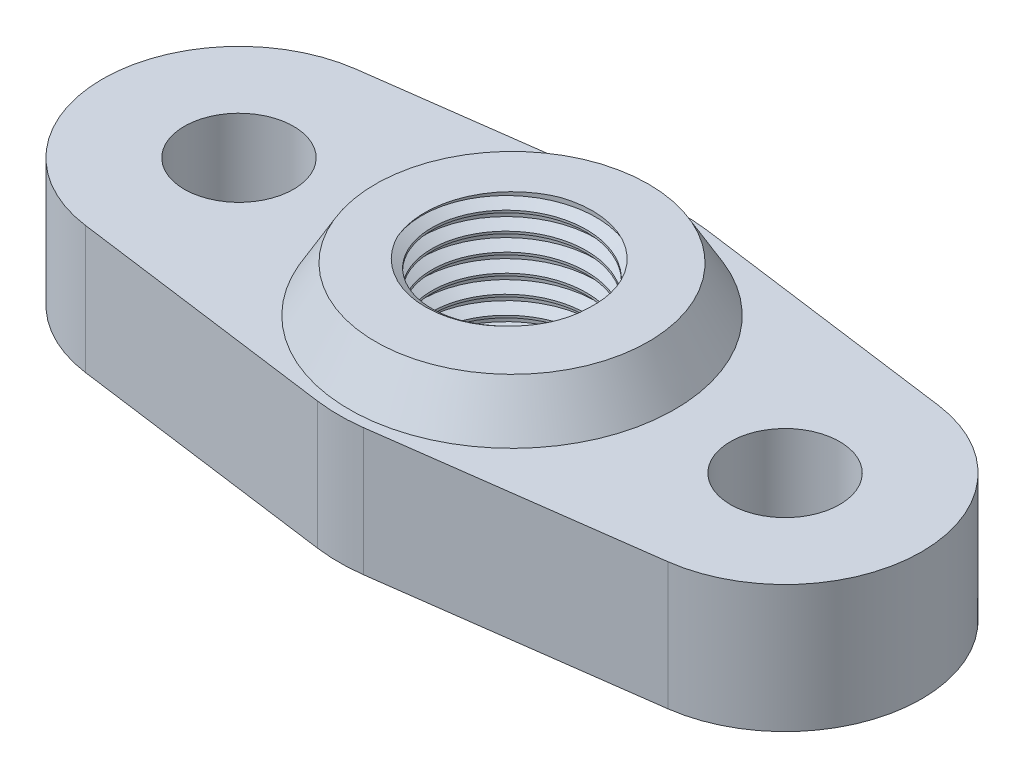
from build123d import *

# Parameters (mm, degrees)
BOSS_EXTRUDE1_DEPTH    = 28
CUT_EXTRUDE1_REACH     = 103.627
SKETCH3_R              = 12
F_25_0MM_DOWEL_HOLE1_D = 34
THREAD1_PITCH          = 4


with BuildPart() as part:
    # Sketch1 → Boss-Extrude1 (new body)
    with BuildSketch(Plane(origin=(0, 0, 0), x_dir=(1, 0, 0), z_dir=(0, 1, 0))):
        with BuildLine():
            Line((-64, 29.732137495), (-5.066666667, 37.660707493))
            ThreePointArc((-5.066666667, 37.660707493), (0, 38), (5.066666667, 37.660707493))
            Line((5.066666667, 37.660707493), (64, 29.732137495))
            ThreePointArc((64, 29.732137495), (90, 0), (64, -29.732137495))
            Line((64, -29.732137495), (5.066666667, -37.660707493))
            ThreePointArc((5.066666667, -37.660707493), (0, -38), (-5.066666667, -37.660707493))
            Line((-5.066666667, -37.660707493), (-64, -29.732137495))
            ThreePointArc((-64, -29.732137495), (-90, 0), (-64, 29.732137495))
        make_face()
    extrude(amount=BOSS_EXTRUDE1_DEPTH)

    # Sketch2 → Revolve1 (revolve)
    with BuildSketch(Plane.XY, mode=Mode.PRIVATE) as revolve1_sk:
        Polygon((0, 38), (-30, 38), (-35.773502692, 28), (0, 28), align=None)
    revolve(revolve1_sk.sketch.rotate(Axis((0, 0, 0), (0, 1, 0)), 270), axis=Axis((0, 0, 0), (0, 1, 0)))

    # Sketch3 → Cut-Extrude1 (cut, up to next)
    with BuildSketch(Plane(origin=(0, 28, 0), x_dir=(1, 0, 0), z_dir=(0, 1, 0)), mode=Mode.PRIVATE) as cut_extrude1_sk1:
        with Locations(Location((-60, 0, 0), (0, 0, 270))):
            Circle(SKETCH3_R)
    cut_extrude1_tool1 = extrude(cut_extrude1_sk1.sketch, amount=-CUT_EXTRUDE1_REACH, mode=Mode.PRIVATE) & part.part
    # Sketch3 → Cut-Extrude1 (cut, up to next)
    with BuildSketch(Plane(origin=(0, 28, 0), x_dir=(1, 0, 0), z_dir=(0, 1, 0)), mode=Mode.PRIVATE) as cut_extrude1_sk2:
        with Locations(Location((60, 0, 0), (0, 0, 270))):
            Circle(SKETCH3_R)
    cut_extrude1_tool2 = extrude(cut_extrude1_sk2.sketch, amount=-CUT_EXTRUDE1_REACH, mode=Mode.PRIVATE) & part.part
    add(cut_extrude1_tool1.solids().sort_by_distance((-60, 28, 0))[0], mode=Mode.SUBTRACT)
    add(cut_extrude1_tool2.solids().sort_by_distance((60, 28, 0))[0], mode=Mode.SUBTRACT)

    # Ø25.0mm Dowel Hole1 (through all)
    with Locations(Plane(origin=(0, 38, 0), x_dir=(1, 0, 0), z_dir=(0, 1, 0))):
        with Locations((0, 0)):
            Hole(F_25_0MM_DOWEL_HOLE1_D / 2)

    # Thread1: the profile of Thread Profile1 profile screwed along a right-hand helix of 12 turns, 12 arcs to a turn; built about Z, then put on its axis
    thread1_z = Axis((0, 0, 0), (0, 0, 1))
    thread1_corners = [(16.9997, 0, -0.000173205), (16.9997, 0, 3.500173194), (19.1650635, 0, 2.249999995), (19.1650635, 0, 1.249999995)]
    with BuildLine(mode=Mode.PRIVATE) as thread1_profile:
        Line(thread1_corners[0], thread1_corners[1])
        Line(thread1_corners[1], thread1_corners[2])
        Line(thread1_corners[2], thread1_corners[3])
        Line(thread1_corners[3], thread1_corners[0])
    thread1_cap = Face(thread1_profile.wire())
    thread1_turn_angles = [0, 15, 30, 45, 60, 75, 90, 105, 120, 135, 150, 165, 180, 195, 210, 225, 240, 255, 270, 285, 300, 315, 330, 345, 360]
    thread1_turn_weights = [1, 0.9659258262890683, 1, 0.9659258262890683, 1, 0.9659258262890683, 1, 0.9659258262890683, 1, 0.9659258262890683, 1, 0.9659258262890683, 1, 0.9659258262890683, 1, 0.9659258262890683, 1, 0.9659258262890683, 1, 0.9659258262890683, 1, 0.9659258262890683, 1, 0.9659258262890683, 1]
    thread1_turn_rails = [Edge.make_bspline([Vector(p[0], p[1], 0).rotate(thread1_z, thread1_turn_angles[k]) / thread1_turn_weights[k] + Vector(0, 0, p[2] + THREAD1_PITCH * thread1_turn_angles[k] / 360) for k in range(25)], [0, 0, 0, 1, 1, 2, 2, 3, 3, 4, 4, 5, 5, 6, 6, 7, 7, 8, 8, 9, 9, 10, 10, 11, 11, 12, 12, 12], 2, thread1_turn_weights) for p in thread1_corners]
    thread1_turn_sides = [Face.make_surface_from_curves(thread1_turn_rails[p[0]], thread1_turn_rails[p[1]]) for p in [(0, 1), (1, 2), (2, 3), (3, 0)]]
    thread1 = Plane(origin=(0, 44, 0), x_dir=(-1, 0, 0), z_dir=(0, -1, 0)) * Solid(Shell([*[p.moved(Location((0, 0, THREAD1_PITCH * i))) for i in range(12) for p in thread1_turn_sides], thread1_cap, thread1_cap.rotate(thread1_z, 4320).moved(Location((0, 0, THREAD1_PITCH * 4320 / 360)))]))
    add(thread1, mode=Mode.SUBTRACT)


solid = part.part
